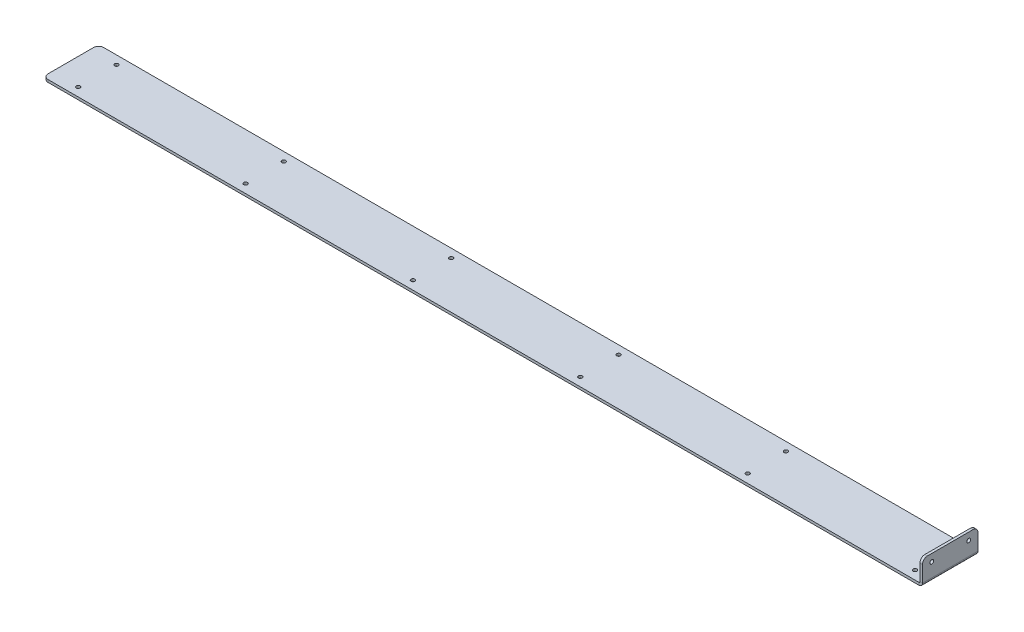
from build123d import *

# Parameters (mm, degrees)
SKETCH1_W                    = 1126.47095
SKETCH1_H                    = 71.4375
BASE_FLANGE1_DEPTH           = 3.2639
EDGE_FLANGE2_DEPTH           = 71.4375
F_10_0_1935_DIAMETER_HOLE1_D = 4.9149
LPATTERN1_COUNT              = 6
LPATTERN1_PITCH              = 215.265
F_10_0_1935_DIAMETER_HOLE2_D = 4.9149
FILLET1_R                    = 6.35


# Sheet-metal steps are written as plain solids
with BuildPart() as part:
    # Sketch1 → Base-Flange1 (new body)
    with BuildSketch(Plane(origin=(0, 0, 0), x_dir=(1, 0, 0), z_dir=(0, 1, 0))):
        with Locations((-563.235475, 0)):
            Rectangle(SKETCH1_W, SKETCH1_H)
    extrude(amount=-BASE_FLANGE1_DEPTH)

    # Edge-Flange2 section (across the edge) → Edge-Flange2 (add)
    with BuildSketch(Plane(origin=(1.27, 0, 35.71875), x_dir=(-1, 0, 0), z_dir=(0, 0, -1))):
        with BuildLine():
            Line((-3.2639, 1.27), (-3.2639, 28.4861))
            Line((-3.2639, 28.4861), (0, 28.4861))
            Line((0, 28.4861), (0, 1.27))
            ThreePointArc((0, 1.27), (0.371974388, 0.371974388), (1.27, 0))
            Line((1.27, 0), (1.27, -3.2639))
            ThreePointArc((1.27, -3.2639), (-1.935951435, -1.935951435), (-3.2639, 1.27))
        make_face()
    extrude(amount=EDGE_FLANGE2_DEPTH)

    # #10 (0.1935) Diameter Hole1 (through all)
    with Locations(Plane(origin=(0, 0, 0), x_dir=(1, 0, 0), z_dir=(0, 1, 0))):
        with Locations((-16.1036, 24.60625), (-16.1036, -24.60625)):
            f_10_0_1935_diameter_hole1 = Hole(F_10_0_1935_DIAMETER_HOLE1_D / 2)

    # LPattern1: #10 (0.1935) Diameter Hole1 ×6
    with Locations(*[(-i * LPATTERN1_PITCH, 0, 0) for i in range(1, LPATTERN1_COUNT)]):
        add(f_10_0_1935_diameter_hole1, mode=Mode.SUBTRACT)

    # #10 (0.1935) Diameter Hole2 (through all)
    with Locations(Plane.ZY.offset(-1.27)):
        with Locations((-23.8125, 19.05), (23.8125, 19.05)):
            Hole(F_10_0_1935_DIAMETER_HOLE2_D / 2)

    # Fillet1
    fillet1_edges = [part.edges().sort_by_distance(p)[0] for p in [
        (2.90195, 28.4861, 35.71875),
        (2.90195, 28.4861, -35.71875),
        (-1126.47095, -1.63195, -35.71875),
        (-1126.47095, -1.63195, 35.71875),
    ]]
    fillet(fillet1_edges, radius=FILLET1_R)


solid = part.part
